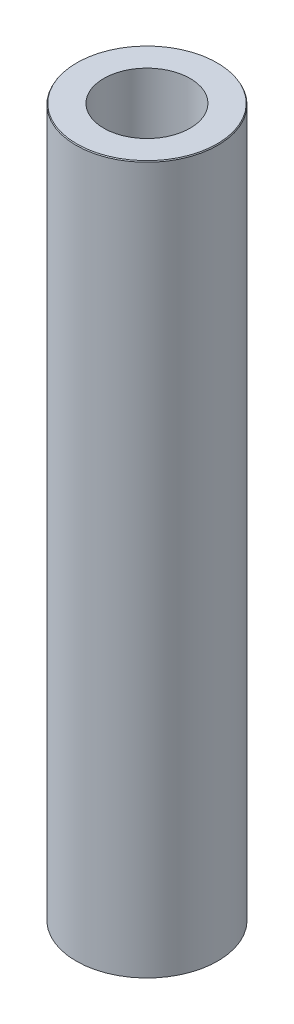
from build123d import *
from OCP.BRepFilletAPI import BRepFilletAPI_MakeChamfer

# Parameters (mm, degrees)
SKETCH1_R           = 60
BOSS_EXTRUDE1_DEPTH = 600
SKETCH2_R           = 36.578726429
CUT_EXTRUDE1_DEPTH  = 606.970296302
CHAMFER1_SIZE       = 0.861007071
CHAMFER1_SIZE2      = 0.497102664


with BuildPart() as part:
    # Sketch1 → Boss-Extrude1 (new body)
    with BuildSketch(Plane(origin=(0, 0, 0), x_dir=(1, 0, 0), z_dir=(0, 1, 0))):
        Circle(SKETCH1_R)
    extrude(amount=BOSS_EXTRUDE1_DEPTH)

    # Sketch2 → Cut-Extrude1 (cut, through all)
    with BuildSketch(Plane(origin=(0, 0, 0), x_dir=(1, 0, 0), z_dir=(0, 1, 0))):
        Circle(SKETCH2_R)
    extrude(amount=CUT_EXTRUDE1_DEPTH, mode=Mode.SUBTRACT)

    # Chamfer1: one chamfer whose edges measure the first distance from different faces: ONE call of the kernel's chamfer builder (chamfer() names one face for all edges)
    chamfer1_edges_1 = [part.edges().sort_by_distance(p)[0] for p in [
        (-60, 600, 0),
    ]]
    chamfer1_side_1 = [part.faces().sort_by_distance(p)[0] for p in [
        (-60, 300, 0),
    ]]
    chamfer1_edges_2 = [part.edges().sort_by_distance(p)[0] for p in [
        (-60, 0, 0),
    ]]
    chamfer1_side_2 = [part.faces().sort_by_distance(p)[0] for p in [
        (-58.302943725, 0, 0),
    ]]
    chamfer1 = BRepFilletAPI_MakeChamfer(part.part.solid().wrapped)
    for e in chamfer1_edges_1:
        chamfer1.Add(CHAMFER1_SIZE, CHAMFER1_SIZE2, e.wrapped, chamfer1_side_1[0].wrapped)  # the first distance lies on this face
    for e in chamfer1_edges_2:
        chamfer1.Add(CHAMFER1_SIZE, CHAMFER1_SIZE2, e.wrapped, chamfer1_side_2[0].wrapped)  # the first distance lies on this face
    add(Compound.cast(chamfer1.Shape()), mode=Mode.REPLACE)


solid = part.part
